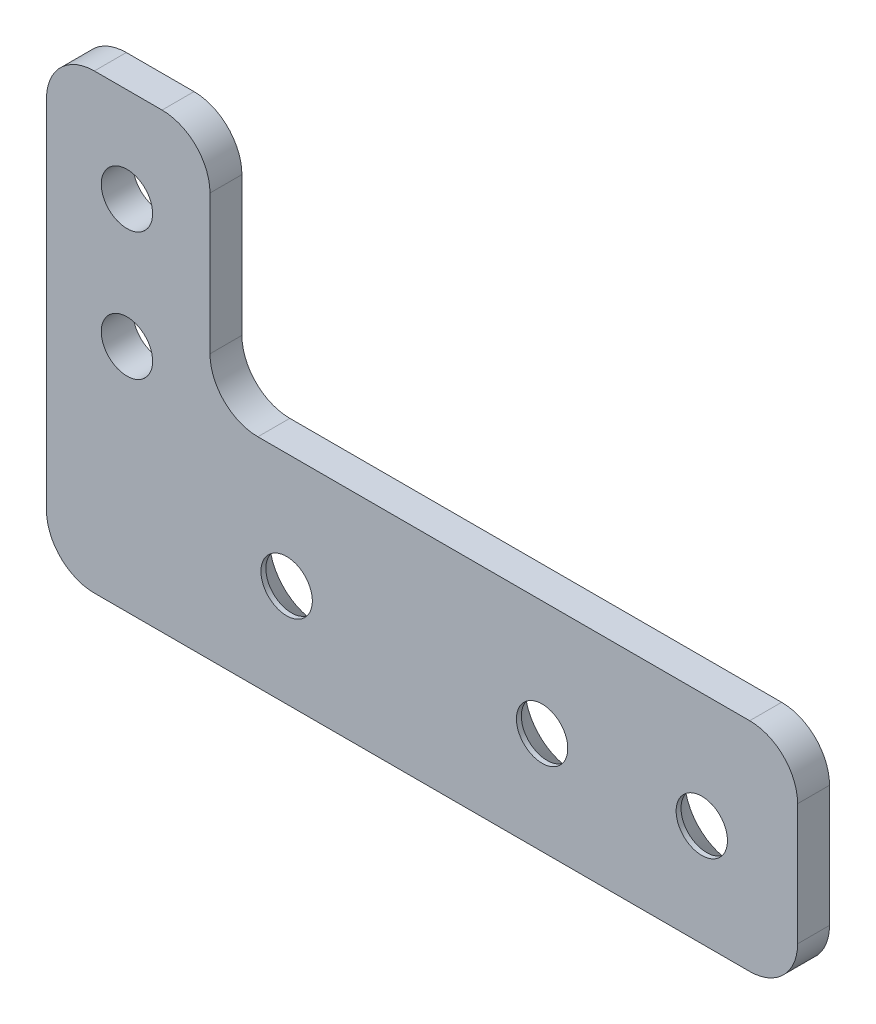
from build123d import *

# Parameters (mm, degrees)
SKETCH1_R                                    = 2.5527
BOSS_EXTRUDE1_DEPTH                          = 3.175
FILLET1_R                                    = 4.7625
CSK_FOR_10_FLAT_HEAD_MACHINE_SCREW3_AT_COUNT = 2
CSK_FOR_10_FLAT_HEAD_MACHINE_SCREW3_AT_PITCH = 15.875
CSK_FOR_10_FLAT_HEAD_MACHINE_SCREW3_2_COUNT  = 2
CSK_FOR_10_FLAT_HEAD_MACHINE_SCREW3_2_PITCH  = 41.275


with BuildPart() as part:
    # Sketch1 → Boss-Extrude1 (new body)
    with BuildSketch(Plane.XY):
        Polygon((-33.401, 23.749), (-33.401, -21.209), (41.275, -21.209), (41.275, 0.381), (-17.145, 0.381), (-17.145, 23.749), align=None)
        with Locations((-25.4, 1.651)):
            Circle(SKETCH1_R, mode=Mode.SUBTRACT)
        with Locations((-25.4, 14.351)):
            Circle(SKETCH1_R, mode=Mode.SUBTRACT)
    extrude(amount=BOSS_EXTRUDE1_DEPTH)

    # Fillet1
    fillet1_edges = [part.edges().sort_by_distance(p)[0] for p in [
        (-33.401, 23.749, 1.5875),
        (-17.145, 23.749, 1.5875),
        (-17.145, 0.381, 1.5875),
        (41.275, 0.381, 1.5875),
        (41.275, -21.209, 1.5875),
        (-33.401, -21.209, 1.5875),
    ]]
    fillet(fillet1_edges, radius=FILLET1_R)

    # Sketch7 → CSK for #10 Flat Head Machine Screw3 (revolve, cut)
    with BuildSketch(Plane(origin=(31.75, -11.049, 0), x_dir=(0, 1, 0), z_dir=(1, 0, 0))):
        Polygon((0, 0), (0, 3.175), (2.5527, 3.175), (2.5527, 2.688180894), (4.8895, 0), align=None)
    csk_for_10_flat_head_machine_screw3 = revolve(axis=Axis((31.75, -11.049, -6.35), (0, 0, 1)), mode=Mode.SUBTRACT)

    # CSK for #10 Flat Head Machine Screw3 at: CSK for #10 Flat Head Machine Screw3 ×2
    with Locations(*[(-i * CSK_FOR_10_FLAT_HEAD_MACHINE_SCREW3_AT_PITCH, 0, 0) for i in range(1, CSK_FOR_10_FLAT_HEAD_MACHINE_SCREW3_AT_COUNT)]):
        add(csk_for_10_flat_head_machine_screw3, mode=Mode.SUBTRACT)

    # CSK for _10 Flat Head Machine Screw3 2: CSK for #10 Flat Head Machine Screw3 ×2
    with Locations(*[(-i * CSK_FOR_10_FLAT_HEAD_MACHINE_SCREW3_2_PITCH, 0, 0) for i in range(1, CSK_FOR_10_FLAT_HEAD_MACHINE_SCREW3_2_COUNT)]):
        add(csk_for_10_flat_head_machine_screw3, mode=Mode.SUBTRACT)


solid = part.part
